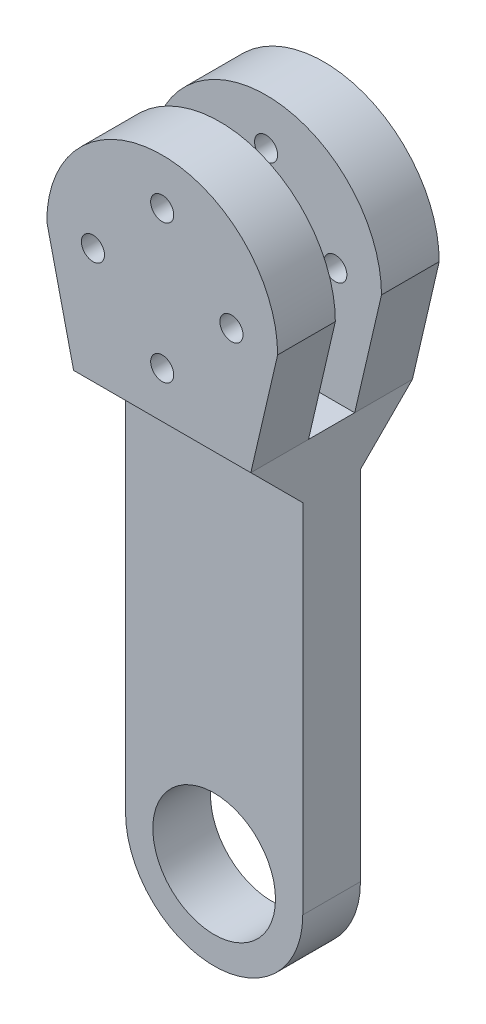
from build123d import *

# Parameters (mm, degrees)
SKETCH1_R           = 6.75
BOSS_EXTRUDE1_DEPTH = 3.175
SKETCH4_R           = 1.27
BOSS_EXTRUDE2_DEPTH = 8.89
CHAMFER1_SIZE       = 5.71
CUT_EXTRUDE1_DEPTH  = 2.54


with BuildPart() as part:
    # Sketch1 → Boss-Extrude1 (new, symmetric)
    with BuildSketch(Plane.XY):
        with BuildLine():
            Line((-9.75, 0), (-9.75, 45))
            Line((-9.75, 45), (9.75, 45))
            Line((9.75, 45), (9.75, 0))
            ThreePointArc((9.75, 0), (0, -9.75), (-9.75, 0))
        make_face()
        Circle(SKETCH1_R, mode=Mode.SUBTRACT)
    extrude(amount=BOSS_EXTRUDE1_DEPTH, both=True)

    # Sketch4 → Boss-Extrude2 (add, symmetric)
    with BuildSketch(Plane.XY):
        with BuildLine():
            Line((-12.7, 57.7), (-9.75, 45))
            Line((-9.75, 45), (9.75, 45))
            Line((9.75, 45), (12.7, 57.7))
            ThreePointArc((12.7, 57.7), (0, 70.4), (-12.7, 57.7))
        make_face()
        with Locations(Location((0, 65.32, 0), (0, 0, 180))):
            Circle(SKETCH4_R, mode=Mode.SUBTRACT)
        with Locations(Location((7.62, 57.7, 0), (0, 0, 180))):
            Circle(SKETCH4_R, mode=Mode.SUBTRACT)
        with Locations(Location((0, 50.08, 0), (0, 0, 180))):
            Circle(SKETCH4_R, mode=Mode.SUBTRACT)
        with Locations(Location((-7.62, 57.7, 0), (0, 0, 180))):
            Circle(SKETCH4_R, mode=Mode.SUBTRACT)
    extrude(amount=BOSS_EXTRUDE2_DEPTH, both=True)

    # Chamfer1
    # the kernel refuses this chamfer: 5.71 mm, written as the material it adds along each edge
    with BuildSketch(Plane(origin=(-9.75, 45, 3.175), x_dir=(0, 0.02749587661058595, 0.9996219169112968), z_dir=(1, 0, 0))) as chamfer1_piece_1_section:
        Polygon((CHAMFER1_SIZE * 0.999621916911, CHAMFER1_SIZE * 0.0274958766106), (-CHAMFER1_SIZE * 0.0274958766106, CHAMFER1_SIZE * 0.999621916911), (0, 0), align=None)
    chamfer1_piece_1 = extrude(amount=19.5, mode=Mode.PRIVATE)
    chamfer1_piece_1 = split(chamfer1_piece_1, bisect_by=Plane(origin=(-9.076297476, 42.099653541, 4.47568677), z_dir=(-0.9740670228457147, -0.2262596627869977, 0)), keep=Keep.TOP, mode=Mode.PRIVATE)
    add(chamfer1_piece_1)
    with BuildSketch(Plane(origin=(-9.75, 45, 3.175), x_dir=(0, 0.02749587661058595, 0.9996219169112968), z_dir=(1, 0, 0))) as chamfer1_piece_2_section:
        Polygon((CHAMFER1_SIZE * 0.999621916911, CHAMFER1_SIZE * 0.0274958766106), (-CHAMFER1_SIZE * 0.0274958766106, CHAMFER1_SIZE * 0.999621916911), (0, 0), align=None)
    chamfer1_piece_2 = extrude(amount=19.5, mode=Mode.PRIVATE)
    chamfer1_piece_2 = split(chamfer1_piece_2, bisect_by=Plane(origin=(-8.84718109, 41.113288082, 5.085534979), z_dir=(0.9740670228457147, 0.2262596627869977, 0)), keep=Keep.TOP, mode=Mode.PRIVATE)
    chamfer1_piece_2 = split(chamfer1_piece_2, bisect_by=Plane(origin=(8.84718109, 41.113288082, 5.085534979), z_dir=(-0.9740670228457147, 0.2262596627869977, 0)), keep=Keep.TOP, mode=Mode.PRIVATE)
    add(chamfer1_piece_2)
    with BuildSketch(Plane(origin=(-9.75, 45, 3.175), x_dir=(0, 0.02749587661058595, 0.9996219169112968), z_dir=(1, 0, 0))) as chamfer1_piece_3_section:
        Polygon((CHAMFER1_SIZE * 0.999621916911, CHAMFER1_SIZE * 0.0274958766106), (-CHAMFER1_SIZE * 0.0274958766106, CHAMFER1_SIZE * 0.999621916911), (0, 0), align=None)
    chamfer1_piece_3 = extrude(amount=19.5, mode=Mode.PRIVATE)
    chamfer1_piece_3 = split(chamfer1_piece_3, bisect_by=Plane(origin=(9.076297476, 42.099653541, 4.47568677), z_dir=(0.9740670228457147, -0.2262596627869977, 0)), keep=Keep.TOP, mode=Mode.PRIVATE)
    add(chamfer1_piece_3)
    with BuildSketch(Plane(origin=(-9.75, 45, -3.175), x_dir=(0, 0.02749587661058595, -0.9996219169112968), z_dir=(1, 0, 0))) as chamfer1_piece_4_section:
        Polygon((CHAMFER1_SIZE * 0.999621916911, -CHAMFER1_SIZE * 0.0274958766106), (-CHAMFER1_SIZE * 0.0274958766106, -CHAMFER1_SIZE * 0.999621916911), (0, 0), align=None)
    chamfer1_piece_4 = extrude(amount=19.5, mode=Mode.PRIVATE)
    chamfer1_piece_4 = split(chamfer1_piece_4, bisect_by=Plane(origin=(-9.076297476, 42.099653541, -4.47568677), z_dir=(-0.9740670228457147, -0.2262596627869977, 0)), keep=Keep.TOP, mode=Mode.PRIVATE)
    add(chamfer1_piece_4)
    with BuildSketch(Plane(origin=(-9.75, 45, -3.175), x_dir=(0, 0.02749587661058595, -0.9996219169112968), z_dir=(1, 0, 0))) as chamfer1_piece_5_section:
        Polygon((CHAMFER1_SIZE * 0.999621916911, -CHAMFER1_SIZE * 0.0274958766106), (-CHAMFER1_SIZE * 0.0274958766106, -CHAMFER1_SIZE * 0.999621916911), (0, 0), align=None)
    chamfer1_piece_5 = extrude(amount=19.5, mode=Mode.PRIVATE)
    chamfer1_piece_5 = split(chamfer1_piece_5, bisect_by=Plane(origin=(-8.84718109, 41.113288082, -5.085534979), z_dir=(0.9740670228457147, 0.2262596627869977, 0)), keep=Keep.TOP, mode=Mode.PRIVATE)
    chamfer1_piece_5 = split(chamfer1_piece_5, bisect_by=Plane(origin=(8.84718109, 41.113288082, -5.085534979), z_dir=(-0.9740670228457147, 0.2262596627869977, 0)), keep=Keep.TOP, mode=Mode.PRIVATE)
    add(chamfer1_piece_5)
    with BuildSketch(Plane(origin=(-9.75, 45, -3.175), x_dir=(0, 0.02749587661058595, -0.9996219169112968), z_dir=(1, 0, 0))) as chamfer1_piece_6_section:
        Polygon((CHAMFER1_SIZE * 0.999621916911, -CHAMFER1_SIZE * 0.0274958766106), (-CHAMFER1_SIZE * 0.0274958766106, -CHAMFER1_SIZE * 0.999621916911), (0, 0), align=None)
    chamfer1_piece_6 = extrude(amount=19.5, mode=Mode.PRIVATE)
    chamfer1_piece_6 = split(chamfer1_piece_6, bisect_by=Plane(origin=(9.076297476, 42.099653541, -4.47568677), z_dir=(0.9740670228457147, -0.2262596627869977, 0)), keep=Keep.TOP, mode=Mode.PRIVATE)
    add(chamfer1_piece_6)

    # Sketch5 → Cut-Extrude1 (cut, symmetric)
    with BuildSketch(Plane.XY):
        with BuildLine():
            Line((-12.7, 57.7), (-9.75, 45))
            Line((-9.75, 45), (9.75, 45))
            Line((9.75, 45), (12.7, 57.7))
            ThreePointArc((12.7, 57.7), (0, 70.4), (-12.7, 57.7))
        make_face()
    extrude(amount=CUT_EXTRUDE1_DEPTH, both=True, mode=Mode.SUBTRACT)


solid = part.part
